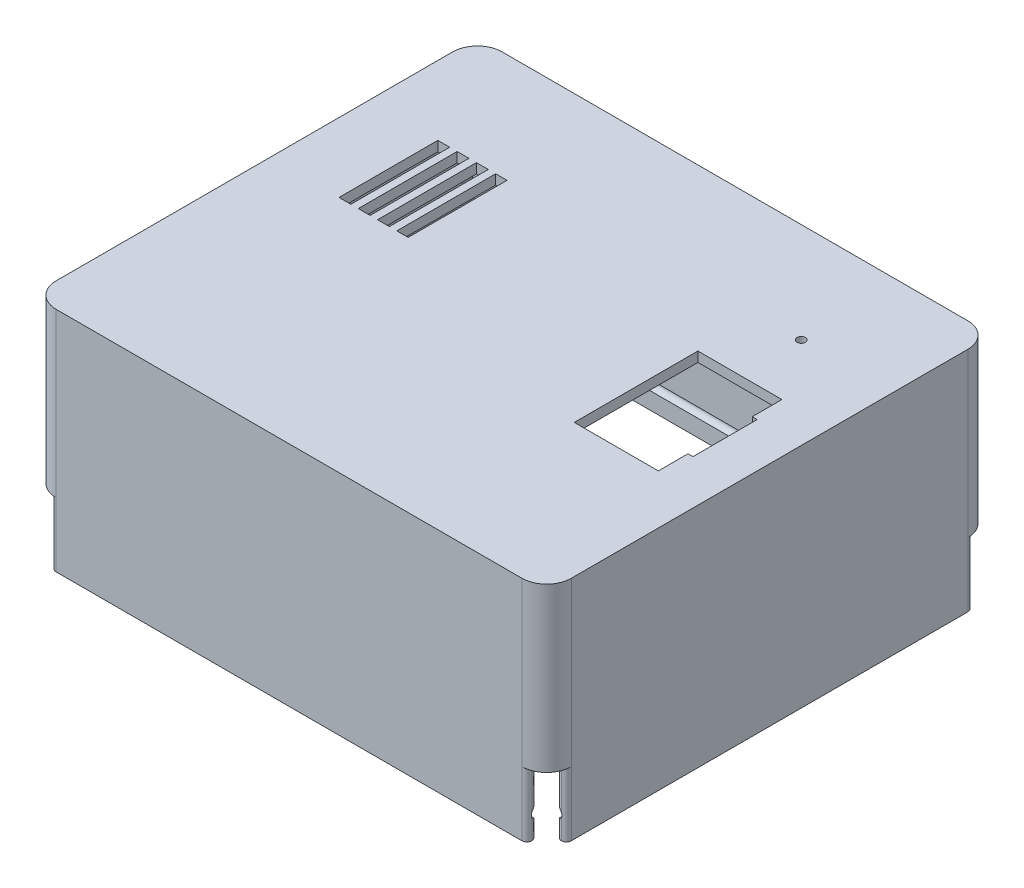
from build123d import *

# Parameters (mm, degrees)
ESQUISSE1_W                = 104.2
ESQUISSE1_H                = 90.2
BOSS_EXTRU_1_DEPTH         = 2
ESQUISSE2_W                = 104.2
ESQUISSE2_H                = 90.2
ESQUISSE2_W_2              = 100.2
ESQUISSE2_H_2              = 86.2
BOSS_EXTRU_2_DEPTH         = 44
ENL_V_MAT_EXTRU_1_DEPTH    = 13
SYM_TRIE2_COPY_1_DEPTH     = 13
CONG_3_R                   = 1
CONG_1_R                   = 5
ENL_V_MAT_EXTRU_2_DEPTH    = 82.758302331
ENL_V_MAT_EXTRU_3_DEPTH    = 82.758302438
ESQUISSE15_W               = 100.6
ESQUISSE15_H               = 86.6
ENL_V_MAT_EXTRU_10_DEPTH   = 4.5
ENL_V_MAT_EXTRU_12_REACH   = 83.758
ESQUISSE17_W               = 14
ESQUISSE17_H               = 20
ESQUISSE19_R               = 3.5
BOSS_EXTRU_5_DEPTH         = 6
ESQUISSE20_R               = 0.85
ENL_V_MAT_EXTRU_13_DEPTH   = 6.5
ENL_V_MAT_EXTRU_16_REACH   = 84.852
ESQUISSE23_W               = 17
ESQUISSE23_H               = 25
ENL_V_MAT_EXTRU_17_REACH   = 83.758
ESQUISSE24_R               = 0.85
ENL_V_MAT_EXTRU_18_REACH   = 84.852
ESQUISSE25_W               = 1
ESQUISSE25_H               = 13
ESQUISSE26_W               = 1.8
ESQUISSE26_H               = 5.5
ESQUISSE26_W_2             = 24
ESQUISSE26_H_2             = 2
ESQUISSE26_W_3             = 1
BOSS_EXTRU_6_DEPTH         = 2.1
ESQUISSE27_W               = 5.5
ESQUISSE27_H               = 7.5
BOSS_EXTRU_7_DEPTH         = 2
ESQUISSE29_W               = 1.5
ESQUISSE29_H               = 20
BOSS_EXTRU_8_DEPTH         = 2
R_P_TITION_LIN_AIRE1_COUNT = 3
R_P_TITION_LIN_AIRE1_PITCH = 3.9
CONG_4_R                   = 3


with BuildPart() as part:
    # Esquisse1 → Boss.-Extru.1 (new body)
    with BuildSketch(Plane(origin=(0, 0, 0), x_dir=(1, 0, 0), z_dir=(0, 1, 0))):
        Rectangle(ESQUISSE1_W, ESQUISSE1_H)
    extrude(amount=BOSS_EXTRU_1_DEPTH)

    # Esquisse2 → Boss.-Extru.2 (add)
    with BuildSketch(Plane.XZ):
        Rectangle(ESQUISSE2_W, ESQUISSE2_H)
        Rectangle(ESQUISSE2_W_2, ESQUISSE2_H_2, mode=Mode.SUBTRACT)
    extrude(amount=BOSS_EXTRU_2_DEPTH)

    # Esquisse3 → Enlèv. mat.-Extru.1 (cut)
    with BuildSketch(Plane.XZ.offset(44)):
        Polygon((-50.1, 41.1), (-50.1, 43.1), (-48.1, 43.1), (-48.1, 45.1), (-52.1, 45.1), (-52.1, 41.1), align=None)
    enl_v_mat_extru_1 = extrude(amount=-ENL_V_MAT_EXTRU_1_DEPTH, mode=Mode.SUBTRACT)

    # Symétrie1: Enlèv. mat.-Extru.1 across plane
    add(enl_v_mat_extru_1.mirror(Plane.XY), mode=Mode.SUBTRACT)

    # Symétrie2: Enlèv. mat.-Extru.1 across plane
    add(enl_v_mat_extru_1.mirror(Plane(origin=(0, 0, 0), x_dir=(0, 0, 1), z_dir=(1, 0, 0))), mode=Mode.SUBTRACT)

    # Symétrie2 copy 1 sketch → Symétrie2 copy 1 (cut)
    with BuildSketch(Plane(origin=(0, -44, 0), x_dir=(-1, 0, 0), z_dir=(0, -1, 0))):
        Polygon((-50.1, 41.1), (-50.1, 43.1), (-48.1, 43.1), (-48.1, 45.1), (-52.1, 45.1), (-52.1, 41.1), align=None)
    extrude(amount=-SYM_TRIE2_COPY_1_DEPTH, mode=Mode.SUBTRACT)

    # Congé3
    cong_3_edges = [part.edges().sort_by_distance(p)[0] for p in [
        (-48.1, -37.5, 45.1),
        (-48.1, -37.5, 43.1),
        (-50.1, -37.5, 41.1),
        (-52.1, -37.5, 41.1),
        (48.1, -37.5, 45.1),
        (48.1, -37.5, 43.1),
        (52.1, -37.5, 41.1),
        (50.1, -37.5, 41.1),
        (52.1, -37.5, -41.1),
        (50.1, -37.5, -41.1),
        (48.1, -37.5, -43.1),
        (48.1, -37.5, -45.1),
        (-48.1, -37.5, -45.1),
        (-48.1, -37.5, -43.1),
        (-50.1, -37.5, -41.1),
        (-52.1, -37.5, -41.1),
    ]]
    fillet(cong_3_edges, radius=CONG_3_R - 0.0001)  # a hair under: the kernel refuses the full size

    # Congé1
    cong_1_edges = [part.edges().sort_by_distance(p)[0] for p in [
        (52.1, -14.5, 45.1),
        (52.1, -14.5, -45.1),
        (-52.1, -14.5, -45.1),
        (-52.1, -14.5, 45.1),
    ]]
    fillet(cong_1_edges, radius=CONG_1_R)

    # Esquisse4 → Enlèv. mat.-Extru.2 (cut, symmetric)
    with BuildSketch(Plane(origin=(0, 0, 0), x_dir=(0, 0, -1), z_dir=(1, 0, 0))):
        with BuildLine():
            Line((-43.1, -38.4), (-43.1, -40.6))
            ThreePointArc((-43.1, -40.6), (-44.2, -39.5), (-43.1, -38.4))
        make_face()
    enl_v_mat_extru_2 = extrude(amount=ENL_V_MAT_EXTRU_2_DEPTH, both=True, mode=Mode.SUBTRACT)

    # Symétrie4: Enlèv. mat.-Extru.2 across plane
    add(enl_v_mat_extru_2.mirror(Plane.XY), mode=Mode.SUBTRACT)

    # Esquisse5 → Enlèv. mat.-Extru.3 (cut, symmetric)
    with BuildSketch(Plane.XY):
        with BuildLine():
            Line((-50.1, -38.4), (-50.1, -40.6))
            ThreePointArc((-50.1, -40.6), (-51.2, -39.5), (-50.1, -38.4))
        make_face()
    enl_v_mat_extru_3 = extrude(amount=ENL_V_MAT_EXTRU_3_DEPTH, both=True, mode=Mode.SUBTRACT)

    # Symétrie5: Enlèv. mat.-Extru.3 across plane
    add(enl_v_mat_extru_3.mirror(Plane(origin=(0, 0, 0), x_dir=(0, 0, 1), z_dir=(1, 0, 0))), mode=Mode.SUBTRACT)

    # Esquisse15 → Enlèv. mat.-Extru.10 (cut)
    with BuildSketch(Plane.XZ.offset(44)):
        Rectangle(ESQUISSE15_W, ESQUISSE15_H)
    extrude(amount=-ENL_V_MAT_EXTRU_10_DEPTH, mode=Mode.SUBTRACT)

    # Esquisse17 → Enlèv. mat.-Extru.12 (cut, up to next)
    with BuildSketch(Plane.XZ, mode=Mode.PRIVATE) as enl_v_mat_extru_12_sk1:
        with Locations((-31.1, -13.1)):
            Rectangle(ESQUISSE17_W, ESQUISSE17_H)
    enl_v_mat_extru_12_tool1 = extrude(enl_v_mat_extru_12_sk1.sketch, amount=-ENL_V_MAT_EXTRU_12_REACH, mode=Mode.PRIVATE) & part.part
    add(enl_v_mat_extru_12_tool1.solids().sort_by_distance((-31.1, 0, -13.1))[0], mode=Mode.SUBTRACT)

    # Esquisse19 → Boss.-Extru.5 (add)
    with BuildSketch(Plane.XZ):
        with Locations(Location((-41.1, 1.9, 0), (0, 0, 270))):
            Circle(ESQUISSE19_R)
        with Locations(Location((-31.1, -28.1, 0), (0, 0, 270))):
            Circle(ESQUISSE19_R)
        with Locations(Location((-21.1, 1.9, 0), (0, 0, 270))):
            Circle(ESQUISSE19_R)
    extrude(amount=BOSS_EXTRU_5_DEPTH)

    # Esquisse20 → Enlèv. mat.-Extru.13 (cut)
    with BuildSketch(Plane.XZ.offset(6)):
        with Locations(Location((-41.1, 1.9, 0), (0, 0, 270))):
            Circle(ESQUISSE20_R)
        with Locations(Location((-21.1, 1.9, 0), (0, 0, 270))):
            Circle(ESQUISSE20_R)
        with Locations(Location((-31.1, -28.1, 0), (0, 0, 270))):
            Circle(ESQUISSE20_R)
    extrude(amount=-ENL_V_MAT_EXTRU_13_DEPTH, mode=Mode.SUBTRACT)

    # Esquisse23 → Enlèv. mat.-Extru.16 (cut, up to next)
    with BuildSketch(Plane(origin=(0, 2, 0), x_dir=(1, 0, 0), z_dir=(0, 1, 0)), mode=Mode.PRIVATE) as enl_v_mat_extru_16_sk1:
        with Locations((33.6, 0)):
            Rectangle(ESQUISSE23_W, ESQUISSE23_H)
    enl_v_mat_extru_16_tool1 = extrude(enl_v_mat_extru_16_sk1.sketch, amount=-ENL_V_MAT_EXTRU_16_REACH, mode=Mode.PRIVATE) & part.part
    add(enl_v_mat_extru_16_tool1.solids().sort_by_distance((33.6, 2, 0))[0], mode=Mode.SUBTRACT)

    # Esquisse24 → Enlèv. mat.-Extru.17 (cut, up to next)
    with BuildSketch(Plane.XZ, mode=Mode.PRIVATE) as enl_v_mat_extru_17_sk1:
        with Locations(Location((33.6, -24.9, 0), (0, 0, 270))):
            Circle(ESQUISSE24_R)
    enl_v_mat_extru_17_tool1 = extrude(enl_v_mat_extru_17_sk1.sketch, amount=-ENL_V_MAT_EXTRU_17_REACH, mode=Mode.PRIVATE) & part.part
    add(enl_v_mat_extru_17_tool1.solids().sort_by_distance((33.6, 0, -24.9))[0], mode=Mode.SUBTRACT)

    # Esquisse25 → Enlèv. mat.-Extru.18 (cut, up to next)
    with BuildSketch(Plane(origin=(0, 2, 0), x_dir=(1, 0, 0), z_dir=(0, 1, 0)), mode=Mode.PRIVATE) as enl_v_mat_extru_18_sk1:
        with Locations((42.6, 0)):
            Rectangle(ESQUISSE25_W, ESQUISSE25_H)
    enl_v_mat_extru_18_tool1 = extrude(enl_v_mat_extru_18_sk1.sketch, amount=-ENL_V_MAT_EXTRU_18_REACH, mode=Mode.PRIVATE) & part.part
    add(enl_v_mat_extru_18_tool1.solids().sort_by_distance((42.6, 2, 0))[0], mode=Mode.SUBTRACT)

    # Esquisse26 → Boss.-Extru.6 (add)
    with BuildSketch(Plane.XZ):
        with Locations((22.5, 13.25)):
            Rectangle(ESQUISSE26_W, ESQUISSE26_H)
        with Locations((33.6, 17)):
            Rectangle(ESQUISSE26_W_2, ESQUISSE26_H_2)
        with Locations((45.1, 13.25)):
            Rectangle(ESQUISSE26_W_3, ESQUISSE26_H)
    extrude(amount=BOSS_EXTRU_6_DEPTH)

    # Esquisse27 → Boss.-Extru.7 (add)
    with BuildSketch(Plane.XZ.offset(2.1)):
        with Locations((24.35, 14.25)):
            Rectangle(ESQUISSE27_W, ESQUISSE27_H)
        with Locations((42.85, 14.25)):
            Rectangle(ESQUISSE27_W, ESQUISSE27_H)
    extrude(amount=BOSS_EXTRU_7_DEPTH)

    # Esquisse29 → Boss.-Extru.8 (add)
    with BuildSketch(Plane.XZ):
        with Locations((-34.95, -13.1)):
            Rectangle(ESQUISSE29_W, ESQUISSE29_H)
    boss_extru_8 = extrude(amount=-BOSS_EXTRU_8_DEPTH)

    # Répétition linéaire1: Boss.-Extru.8 ×3
    with Locations(*[(i * R_P_TITION_LIN_AIRE1_PITCH, 0, 0) for i in range(1, R_P_TITION_LIN_AIRE1_COUNT)]):
        add(boss_extru_8)

    # Congé4
    cong_4_edges = [part.edges().sort_by_distance(p)[0] for p in [
        (-50.1, -15.5, -43.1),
        (50.1, -15.5, -43.1),
        (50.1, -15.5, 43.1),
        (-50.1, -15.5, 43.1),
    ]]
    fillet(cong_4_edges, radius=CONG_4_R - 0.0001)  # a hair under: the kernel refuses the full size


solid = part.part
